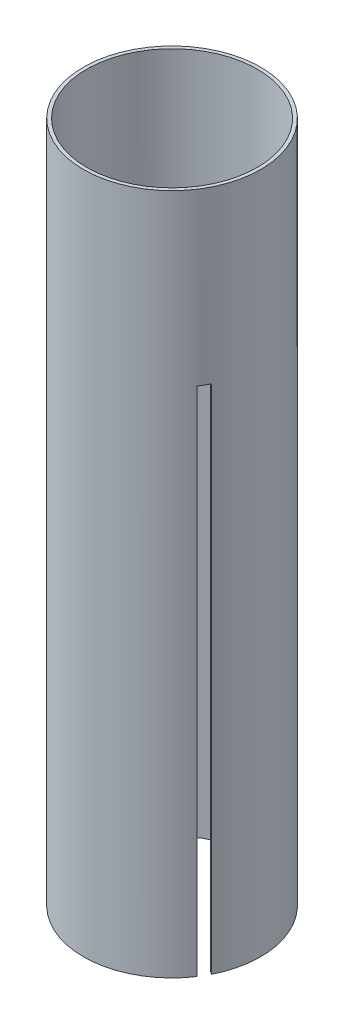
from build123d import *

# Parameters (mm, degrees)
SKETCH2_R           = 39.624
SKETCH2_R_2         = 38.1
BOSS_EXTRUDE1_DEPTH = 304.8
SKETCH3_W           = 4.7625
SKETCH3_H           = 228.6
CUT_EXTRUDE1_DEPTH  = 310.908313461
CIRPATTERN1_COUNT   = 3


with BuildPart() as part:
    # Sketch2 → Boss-Extrude1 (new body)
    with BuildSketch(Plane(origin=(0, 0, 0), x_dir=(1, 0, 0), z_dir=(0, 1, 0))):
        Circle(SKETCH2_R)
        Circle(SKETCH2_R_2, mode=Mode.SUBTRACT)
    extrude(amount=BOSS_EXTRUDE1_DEPTH)

    # Sketch3 → Cut-Extrude1 (cut, through all)
    with BuildSketch(Plane.XY):
        with Locations((0, 114.3)):
            Rectangle(SKETCH3_W, SKETCH3_H)
    cut_extrude1 = extrude(amount=-CUT_EXTRUDE1_DEPTH, mode=Mode.SUBTRACT)

    # CirPattern1: Cut-Extrude1 ×3 about axis
    cirpattern1_axis = Axis((0, 304.8, 0), (0, -1, 0))
    for i in range(1, CIRPATTERN1_COUNT):
        add(cut_extrude1.rotate(cirpattern1_axis, i * 360 / CIRPATTERN1_COUNT), mode=Mode.SUBTRACT)


solid = part.part
